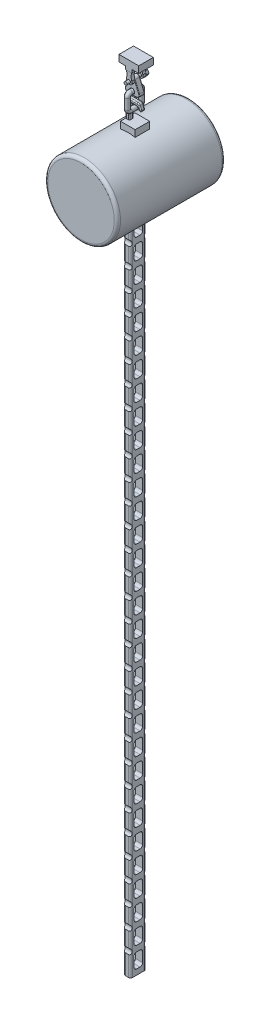
from build123d import *
from build123d.topology import SkipClean

# Parameters (mm, degrees)
SALIENTE_EXTRUIR1_DEPTH  = 28
CROQUIS2_W               = 10.7
CROQUIS2_H               = 6
SALIENTE_EXTRUIR2_DEPTH  = 21
REDONDEO1_R              = 1
CORTAR_EXTRUIR1_REACH    = 41.599
REDONDEO2_R              = 3
CORTAR_EXTRUIR2_REACH    = 41.599
CROQUIS5_R               = 2.815664582
SALIENTE_EXTRUIR3_DEPTH  = 5.5
SALIENTE_EXTRUIR4_START  = 34
CROQUIS7_R               = 2.815664582
SALIENTE_EXTRUIR4_DEPTH  = 34
CROQUIS8_R               = 2.815664582
SALIENTE_EXTRUIR5_DEPTH  = 10
CROQUIS9_R               = 4.7625
CORTAR_EXTRUIR3_DEPTH    = 10
REDONDEO3_R              = 1
CROQUIS10_R              = 4.35
SALIENTE_EXTRUIR6_DEPTH  = 11
CROQUIS11_R              = 4.35
SALIENTE_EXTRUIR7_DEPTH  = 8
CROQUIS13_W              = 28.274940987
CROQUIS13_H              = 11.511843281
SALIENTE_EXTRUIR8_DEPTH  = 10
CROQUIS14_W              = 28.274940987
CROQUIS14_H              = 11.511843281
SALIENTE_EXTRUIR9_DEPTH  = 10
REDONDEO4_R              = 2
SALIENTE_EXTRUIR10_DEPTH = 28
CROQUIS21_R              = 70
SALIENTE_EXTRUIR15_DEPTH = 90
CROQUIS22_R              = 70
SALIENTE_EXTRUIR16_DEPTH = 90
REDONDEO6_R              = 6
CROQUIS23_W              = 20
CROQUIS23_H              = 5.502758385
SALIENTE_EXTRUIR17_DEPTH = 30
CROQUIS24_W              = 13.86692414
CROQUIS24_H              = 30
SALIENTE_EXTRUIR18_DEPTH = 1265
CORTAR_EXTRUIR5_DEPTH    = 13.866924141
MATRIZL1_COUNT           = 32
MATRIZL1_PITCH           = 39.4
REDONDEO7_R              = 4
CORTAR_EXTRUIR6_DEPTH    = 20
MATRIZL2_COUNT           = 31
MATRIZL2_PITCH           = 39.4


# Some blends are built 0.0001 mm under size
with BuildPart() as part:
    # Croquis1 → Saliente-Extruir1 (new body)
    with BuildSketch(Plane.XY):
        Polygon((6.35, 0), (-6.35, 0), (-6.35, 6.35), (-19.05, 6.35), (-19.05, 19.05), (19.05, 19.05), (19.05, 6.35), (6.35, 6.35), align=None)
    extrude(amount=SALIENTE_EXTRUIR1_DEPTH)

    # Croquis2 → Saliente-Extruir2 (add)
    with BuildSketch(Plane.XZ):
        with Locations((0, 24.643277725)):
            Rectangle(CROQUIS2_W, CROQUIS2_H)
        with Locations((0, 3.356722275)):
            Rectangle(CROQUIS2_W, CROQUIS2_H)
    extrude(amount=SALIENTE_EXTRUIR2_DEPTH)

    # Redondeo1
    redondeo1_edges = [part.edges().sort_by_distance(p)[0] for p in [
        (6.35, 0, 14),
        (-6.35, 0, 14),
    ]]
    fillet(redondeo1_edges, radius=REDONDEO1_R - 0.0001)  # a hair under: the kernel refuses the full size

    # Cortar-Extruir1: up to this face of the body (flat: up to its plane)
    cortar_extruir1_end = Plane(part.part.faces().sort_by_distance((0, -10.5, 0.356722275))[0])
    # Croquis3 → Cortar-Extruir1 (cut, up to the picked face)
    with BuildSketch(Plane.XY.offset(27.643277725), mode=Mode.PRIVATE) as cortar_extruir1_sk1:
        with BuildLine():
            Line((5.35, 0), (6.520255164, -7.319974901))
            Line((6.520255164, -7.319974901), (5.35, -13.668985773))
            ThreePointArc((5.35, -13.668985773), (3.981826743, -6.834492886), (5.35, 0))
        make_face()
    cortar_extruir1_tool1 = split(extrude(cortar_extruir1_sk1.sketch, amount=-CORTAR_EXTRUIR1_REACH, mode=Mode.PRIVATE), bisect_by=cortar_extruir1_end, keep=Keep.BOTH, mode=Mode.PRIVATE)
    # Croquis3 → Cortar-Extruir1 (cut, up to the picked face)
    with BuildSketch(Plane.XY.offset(27.643277725), mode=Mode.PRIVATE) as cortar_extruir1_sk2:
        with BuildLine():
            Line((-5.35, 0), (-6.699224092, -7.319974901))
            Line((-6.699224092, -7.319974901), (-5.35, -13.668985773))
            ThreePointArc((-5.35, -13.668985773), (-3.981826743, -6.834492886), (-5.35, 0))
        make_face()
    cortar_extruir1_tool2 = split(extrude(cortar_extruir1_sk2.sketch, amount=-CORTAR_EXTRUIR1_REACH, mode=Mode.PRIVATE), bisect_by=cortar_extruir1_end, keep=Keep.BOTH, mode=Mode.PRIVATE)
    add(cortar_extruir1_tool1.solids().sort_by(Axis((5.166152, -6.89743, 27.643278), (0, 0, -1)))[0], mode=Mode.SUBTRACT)
    add(cortar_extruir1_tool2.solids().sort_by(Axis((-5.22362, -6.902982, 27.643278), (0, 0, -1)))[0], mode=Mode.SUBTRACT)

    # Redondeo2
    redondeo2_edges = [part.edges().sort_by_distance(p)[0] for p in [
        (5.35, -21, 24.643277725),
        (-5.35, -21, 24.643277725),
        (-5.35, -21, 3.356722275),
        (5.35, -21, 3.356722275),
    ]]
    fillet(redondeo2_edges, radius=REDONDEO2_R)

    # Cortar-Extruir2: up to this face of the body (flat: up to its plane)
    cortar_extruir2_end = Plane(part.part.faces().sort_by_distance((0, -10.77673572, 0.356722275))[0])
    # Croquis5 → Cortar-Extruir2 (cut, up to the picked face)
    with BuildSketch(Plane.XY.offset(27.643277725), mode=Mode.PRIVATE) as cortar_extruir2_sk1:
        with Locations((0, -16.615711475)):
            Circle(CROQUIS5_R)
    cortar_extruir2_tool1 = split(extrude(cortar_extruir2_sk1.sketch, amount=-CORTAR_EXTRUIR2_REACH, mode=Mode.PRIVATE), bisect_by=cortar_extruir2_end, keep=Keep.BOTH, mode=Mode.PRIVATE)
    add(cortar_extruir2_tool1.solids().sort_by(Axis((0, -16.615711, 27.643278), (0, 0, -1)))[0], mode=Mode.SUBTRACT)

    # Croquis6 → Saliente-Extruir3 (add)
    with BuildSketch(Plane(origin=(0, 0, 0.356722275), x_dir=(-1, 0, 0), z_dir=(0, 0, -1))):
        Polygon((5.773502692, -16.615711475), (2.886751346, -11.615711475), (-2.886751346, -11.615711475), (-5.773502692, -16.615711475), (-2.886751346, -21.615711475), (2.886751346, -21.615711475), align=None)
    extrude(amount=SALIENTE_EXTRUIR3_DEPTH)

    # Croquis7 → Saliente-Extruir4 (add)
    with BuildSketch(Plane.XY.offset(0.356722275).offset(SALIENTE_EXTRUIR4_START)):
        with Locations(Location((0, -16.615711475, 0), (0, 0, 180))):
            Circle(CROQUIS7_R)
    extrude(amount=-SALIENTE_EXTRUIR4_DEPTH)

    # Croquis8 → Saliente-Extruir5 (add)
    with BuildSketch(Plane(origin=(0, 0, 21.643277725), x_dir=(-1, 0, 0), z_dir=(0, 0, -1))):
        with BuildLine():
            Line((4.933623368, -14.546445792), (13.217945145, -34.298246566))
            ThreePointArc((13.217945145, -34.298246566), (12.681109686, -39.941264611), (7.684909592, -42.618918359))
            Line((7.684909592, -42.618918359), (-7.684909592, -42.618918359))
            ThreePointArc((-7.684909592, -42.618918359), (-12.681109686, -39.941264611), (-13.217945145, -34.298246566))
            Line((-13.217945145, -34.298246566), (-4.933623368, -14.546445792))
            ThreePointArc((-4.933623368, -14.546445792), (0, -11.265711475), (4.933623368, -14.546445792))
        make_face()
        with Locations((0, -16.615711475)):
            Circle(CROQUIS8_R, mode=Mode.SUBTRACT)
    extrude(amount=SALIENTE_EXTRUIR5_DEPTH)

    # Croquis9 → Cortar-Extruir3 (cut)
    with BuildSketch(Plane(origin=(0, 0, 11.643277725), x_dir=(-1, 0, 0), z_dir=(0, 0, -1))):
        with Locations((0, -35.818918359)):
            Circle(CROQUIS9_R)
    extrude(amount=-CORTAR_EXTRUIR3_DEPTH, mode=Mode.SUBTRACT)

    # Redondeo3
    # the kernel refuses this fillet: 1 mm, written as the material it takes off along each edge
    with BuildSketch(Plane(origin=(-4.383053419, -13.233755602, 21.643277725), x_dir=(0, 0, -1), z_dir=(-0.3867786322087512, -0.9221725921251008, 0))) as redondeo3_piece_1_section:
        with BuildLine():
            CenterArc((REDONDEO3_R, REDONDEO3_R), REDONDEO3_R, 180, 90)
            Line((0, REDONDEO3_R), (-REDONDEO3_R * 0.02, REDONDEO3_R))
            Line((-REDONDEO3_R * 0.02, REDONDEO3_R), (-REDONDEO3_R * 0.02, -REDONDEO3_R * 0.02))
            Line((-REDONDEO3_R * 0.02, -REDONDEO3_R * 0.02), (REDONDEO3_R, -REDONDEO3_R * 0.02))
            Line((REDONDEO3_R, -REDONDEO3_R * 0.02), (REDONDEO3_R, 0))
        make_face()
    redondeo3_piece_1 = extrude(amount=22.842243571, mode=Mode.PRIVATE)
    redondeo3_piece_1 = split(redondeo3_piece_1, bisect_by=Plane(origin=(-9.192169717, -25.214604853, 21.643277725), z_dir=(0, 0, -1)), keep=Keep.TOP, mode=Mode.PRIVATE)
    redondeo3_piece_1 = split(redondeo3_piece_1, bisect_by=Plane(origin=(-5.35, -25.214604853, 21.393450476), z_dir=(-1, 0, 0)), keep=Keep.TOP, mode=Mode.PRIVATE)
    add(redondeo3_piece_1, mode=Mode.SUBTRACT)
    with BuildSketch(Plane(origin=(-7.684909592, -36.618918359, 21.643277725), x_dir=(-0.922172592125097, 0.38677863220876035, 0), z_dir=(0.38677863220876035, 0.922172592125097, 0))) as redondeo3_piece_2:
        with BuildLine():
            CenterArc((6 - REDONDEO3_R, -REDONDEO3_R), REDONDEO3_R, 0, 90)
            Line((6, -REDONDEO3_R), (6 + REDONDEO3_R * 0.02, -REDONDEO3_R))
            Line((6 + REDONDEO3_R * 0.02, -REDONDEO3_R), (6 + REDONDEO3_R * 0.02, REDONDEO3_R * 0.02))
            Line((6 + REDONDEO3_R * 0.02, REDONDEO3_R * 0.02), (6 - REDONDEO3_R, REDONDEO3_R * 0.02))
            Line((6 - REDONDEO3_R, REDONDEO3_R * 0.02), (6 - REDONDEO3_R, 0))
        make_face()
    revolve(axis=Axis((-7.684909592, -36.618918359, 21.643277725), (0, 0, 1)), revolution_arc=112.754204396, mode=Mode.SUBTRACT)
    with BuildSketch(Plane(origin=(-7.684909592, -42.618918359, 21.643277725), x_dir=(0, 1, 0), z_dir=(1, 0, 0))) as redondeo3_piece_3:
        with BuildLine():
            CenterArc((REDONDEO3_R, -REDONDEO3_R), REDONDEO3_R, 90, 90)
            Line((0, -REDONDEO3_R), (-REDONDEO3_R * 0.02, -REDONDEO3_R))
            Line((-REDONDEO3_R * 0.02, -REDONDEO3_R), (-REDONDEO3_R * 0.02, REDONDEO3_R * 0.02))
            Line((-REDONDEO3_R * 0.02, REDONDEO3_R * 0.02), (REDONDEO3_R, REDONDEO3_R * 0.02))
            Line((REDONDEO3_R, REDONDEO3_R * 0.02), (REDONDEO3_R, 0))
        make_face()
    extrude(amount=15.369819184, mode=Mode.SUBTRACT)
    with BuildSketch(Plane(origin=(7.684909592, -36.618918359, 21.643277725), x_dir=(0, -1, 0), z_dir=(-1, 0, 0))) as redondeo3_piece_4:
        with BuildLine():
            CenterArc((6 - REDONDEO3_R, -REDONDEO3_R), REDONDEO3_R, 0, 90)
            Line((6, -REDONDEO3_R), (6 + REDONDEO3_R * 0.02, -REDONDEO3_R))
            Line((6 + REDONDEO3_R * 0.02, -REDONDEO3_R), (6 + REDONDEO3_R * 0.02, REDONDEO3_R * 0.02))
            Line((6 + REDONDEO3_R * 0.02, REDONDEO3_R * 0.02), (6 - REDONDEO3_R, REDONDEO3_R * 0.02))
            Line((6 - REDONDEO3_R, REDONDEO3_R * 0.02), (6 - REDONDEO3_R, 0))
        make_face()
    revolve(axis=Axis((7.684909592, -36.618918359, 21.643277725), (0, 0, 1)), revolution_arc=112.754204396, mode=Mode.SUBTRACT)
    with BuildSketch(Plane(origin=(0, -16.615711475, 11.643277725), x_dir=(0.9221725921251007, 0.3867786322087513, 0), z_dir=(0.3867786322087513, -0.9221725921251007, 0))) as redondeo3_piece_5:
        with BuildLine():
            CenterArc((5.35 - REDONDEO3_R, REDONDEO3_R), REDONDEO3_R, 270, 90)
            Line((5.35 - REDONDEO3_R, 0), (5.35 - REDONDEO3_R, -REDONDEO3_R * 0.02))
            Line((5.35 - REDONDEO3_R, -REDONDEO3_R * 0.02), (5.35 + REDONDEO3_R * 0.02, -REDONDEO3_R * 0.02))
            Line((5.35 + REDONDEO3_R * 0.02, -REDONDEO3_R * 0.02), (5.35 + REDONDEO3_R * 0.02, REDONDEO3_R))
            Line((5.35 + REDONDEO3_R * 0.02, REDONDEO3_R), (5.35, REDONDEO3_R))
        make_face()
    revolve(axis=Axis((0, -16.615711475, 11.643277725), (0, 0, 1)), revolution_arc=134.491591209, mode=Mode.SUBTRACT)
    with BuildSketch(Plane(origin=(-4.933623368, -14.546445792, 11.643277725), x_dir=(0, 0, 1), z_dir=(-0.3867786322087512, -0.9221725921251008, 0)), Plane(origin=(13.217945145, -34.298246566, 11.643277725), x_dir=(0, 0, 1), z_dir=(-0.3867786322087514, 0.9221725921251008, 0))) as redondeo3_piece_6:
        with BuildLine():
            CenterArc((REDONDEO3_R, -REDONDEO3_R), REDONDEO3_R, 90, 90)
            Line((0, -REDONDEO3_R), (-REDONDEO3_R * 0.02, -REDONDEO3_R))
            Line((-REDONDEO3_R * 0.02, -REDONDEO3_R), (-REDONDEO3_R * 0.02, REDONDEO3_R * 0.02))
            Line((-REDONDEO3_R * 0.02, REDONDEO3_R * 0.02), (REDONDEO3_R, REDONDEO3_R * 0.02))
            Line((REDONDEO3_R, REDONDEO3_R * 0.02), (REDONDEO3_R, 0))
        make_face()
    extrude(amount=21.418767964, mode=Mode.SUBTRACT)
    with BuildSketch(Plane(origin=(-7.684909592, -36.618918359, 11.643277725), x_dir=(-0.922172592125097, 0.38677863220876035, 0), z_dir=(0.38677863220876035, 0.922172592125097, 0))) as redondeo3_piece_7:
        with BuildLine():
            CenterArc((6 - REDONDEO3_R, REDONDEO3_R), REDONDEO3_R, 270, 90)
            Line((6, REDONDEO3_R), (6 + REDONDEO3_R * 0.02, REDONDEO3_R))
            Line((6 + REDONDEO3_R * 0.02, REDONDEO3_R), (6 + REDONDEO3_R * 0.02, -REDONDEO3_R * 0.02))
            Line((6 + REDONDEO3_R * 0.02, -REDONDEO3_R * 0.02), (6 - REDONDEO3_R, -REDONDEO3_R * 0.02))
            Line((6 - REDONDEO3_R, -REDONDEO3_R * 0.02), (6 - REDONDEO3_R, 0))
        make_face()
    revolve(axis=Axis((-7.684909592, -36.618918359, 11.643277725), (0, 0, 1)), revolution_arc=112.754204396, mode=Mode.SUBTRACT)
    with BuildSketch(Plane(origin=(-7.684909592, -42.618918359, 11.643277725), x_dir=(0, 1, 0), z_dir=(1, 0, 0))) as redondeo3_piece_8:
        with BuildLine():
            CenterArc((REDONDEO3_R, REDONDEO3_R), REDONDEO3_R, 180, 90)
            Line((0, REDONDEO3_R), (-REDONDEO3_R * 0.02, REDONDEO3_R))
            Line((-REDONDEO3_R * 0.02, REDONDEO3_R), (-REDONDEO3_R * 0.02, -REDONDEO3_R * 0.02))
            Line((-REDONDEO3_R * 0.02, -REDONDEO3_R * 0.02), (REDONDEO3_R, -REDONDEO3_R * 0.02))
            Line((REDONDEO3_R, -REDONDEO3_R * 0.02), (REDONDEO3_R, 0))
        make_face()
    extrude(amount=15.369819184, mode=Mode.SUBTRACT)
    with BuildSketch(Plane(origin=(7.684909592, -36.618918359, 11.643277725), x_dir=(0, -1, 0), z_dir=(-1, 0, 0))) as redondeo3_piece_9:
        with BuildLine():
            CenterArc((6 - REDONDEO3_R, REDONDEO3_R), REDONDEO3_R, 270, 90)
            Line((6, REDONDEO3_R), (6 + REDONDEO3_R * 0.02, REDONDEO3_R))
            Line((6 + REDONDEO3_R * 0.02, REDONDEO3_R), (6 + REDONDEO3_R * 0.02, -REDONDEO3_R * 0.02))
            Line((6 + REDONDEO3_R * 0.02, -REDONDEO3_R * 0.02), (6 - REDONDEO3_R, -REDONDEO3_R * 0.02))
            Line((6 - REDONDEO3_R, -REDONDEO3_R * 0.02), (6 - REDONDEO3_R, 0))
        make_face()
    revolve(axis=Axis((7.684909592, -36.618918359, 11.643277725), (0, 0, 1)), revolution_arc=112.754204396, mode=Mode.SUBTRACT)
    with BuildSketch(Plane(origin=(13.217945145, -34.298246566, 21.643277725), x_dir=(0, 0, -1), z_dir=(-0.3867786322087514, 0.9221725921251008, 0))) as redondeo3_piece_10_section:
        with BuildLine():
            CenterArc((REDONDEO3_R, REDONDEO3_R), REDONDEO3_R, 180, 90)
            Line((0, REDONDEO3_R), (-REDONDEO3_R * 0.02, REDONDEO3_R))
            Line((-REDONDEO3_R * 0.02, REDONDEO3_R), (-REDONDEO3_R * 0.02, -REDONDEO3_R * 0.02))
            Line((-REDONDEO3_R * 0.02, -REDONDEO3_R * 0.02), (REDONDEO3_R, -REDONDEO3_R * 0.02))
            Line((REDONDEO3_R, -REDONDEO3_R * 0.02), (REDONDEO3_R, 0))
        make_face()
    redondeo3_piece_10 = extrude(amount=22.842243571, mode=Mode.PRIVATE)
    redondeo3_piece_10 = split(redondeo3_piece_10, bisect_by=Plane(origin=(9.192169717, -25.214604853, 21.643277725), z_dir=(0, 0, -1)), keep=Keep.TOP, mode=Mode.PRIVATE)
    redondeo3_piece_10 = split(redondeo3_piece_10, bisect_by=Plane(origin=(5.35, -25.214604853, 21.393450476), z_dir=(1, 0, 0)), keep=Keep.TOP, mode=Mode.PRIVATE)
    add(redondeo3_piece_10, mode=Mode.SUBTRACT)


with BuildPart() as body_2:
    # Croquis10 → Saliente-Extruir6 (new body)
    with BuildSketch(Plane(origin=(0, 0, 11.643277725), x_dir=(-1, 0, 0), z_dir=(0, 0, -1))):
        with Locations((0, -35.818918359)):
            Circle(CROQUIS10_R)
    extrude(amount=-SALIENTE_EXTRUIR6_DEPTH)

    # Barrer1: sweep along a curve in space
    with BuildLine() as barrer1_path:
        Line((0, -35.818918359, 22.643277725), (0, -35.818918359, 25.643277725))
        ThreePointArc((0, -35.818918359, 25.643277725), (0, -37.283384453, 29.178811631), (0, -40.818918359, 30.643277725))
        Line((0, -40.818918359, 30.643277725), (0, -60.818918359, 30.643277725))
        ThreePointArc((0, -60.818918359, 30.643277725), (0, -64.354452265, 29.178811631), (0, -65.818918359, 25.643277725))
        Line((0, -65.818918359, 25.643277725), (0, -65.818918359, 8.643277725))
        ThreePointArc((0, -65.818918359, 8.643277725), (0, -64.354452265, 5.107743819), (0, -60.818918359, 3.643277725))
        Line((0, -60.818918359, 3.643277725), (0, -40.818918359, 3.643277725))
        ThreePointArc((0, -35.818918359, 8.643277725), (0, -37.283384453, 5.107743819), (0, -40.818918359, 3.643277725))
        Line((0, -35.818918359, 8.643277725), (0, -35.818918359, 11.643277725))
    # Croquis11 → Barrer1 (sweep)
    with BuildSketch(Plane.XY.offset(22.643277725)):
        with Locations((0, -35.818918359)):
            Circle(CROQUIS11_R)
    sweep(path=barrer1_path.line)


with BuildPart() as body_3:
    # Croquis12 → Saliente-Extruir7 (new body)
    with BuildSketch(Plane(origin=(0, 0, 11.643277725), x_dir=(-1, 0, 0), z_dir=(0, 0, -1))):
        with BuildLine():
            Line((-5.818655397, -59.40281157), (5.381115139, -59.40281157))
            ThreePointArc((5.381115139, -59.40281157), (6.795328702, -59.988598008), (7.381115139, -61.40281157))
            Line((7.381115139, -61.40281157), (7.381115139, -89.417879828))
            Line((7.381115139, -89.417879828), (-13.686610906, -89.417879828))
            Line((-13.686610906, -89.417879828), (-13.686610906, -100.929723109))
            Line((-13.686610906, -100.929723109), (14.588330081, -100.929723109))
            Line((14.588330081, -100.929723109), (14.588330081, -57.596469218))
            ThreePointArc((14.588330081, -57.596469218), (13.123863987, -54.060935312), (9.588330081, -52.596469218))
            Line((9.588330081, -52.596469218), (-7.405387753, -52.596469218))
            ThreePointArc((-7.405387753, -52.596469218), (-10.218597223, -53.462965562), (-12.056752406, -55.762128228))
            Line((-12.056752406, -55.762128228), (-14.815295773, -62.757006052))
            ThreePointArc((-14.815295773, -62.757006052), (-14.789184488, -64.287517062), (-13.688486308, -65.351288309))
            Line((-13.688486308, -65.351288309), (-13.600253639, -65.386084291))
            ThreePointArc((-13.600253639, -65.386084291), (-12.38001879, -65.465466072), (-11.341646131, -64.819666744))
            Line((-11.341646131, -64.819666744), (-7.343526509, -60.108683257))
            ThreePointArc((-7.343526509, -60.108683257), (-6.6588171, -59.587838206), (-5.818655397, -59.40281157))
        make_face()
    extrude(amount=-SALIENTE_EXTRUIR7_DEPTH)

    # Croquis13 → Saliente-Extruir8 (add)
    with BuildSketch(Plane(origin=(0, 0, 11.643277725), x_dir=(-1, 0, 0), z_dir=(0, 0, -1))):
        with Locations((0.450859588, -95.173801469)):
            Rectangle(CROQUIS13_W, CROQUIS13_H)
    extrude(amount=SALIENTE_EXTRUIR8_DEPTH)

    # Croquis14 → Saliente-Extruir9 (add)
    with BuildSketch(Plane.XY.offset(19.643277725)):
        with Locations((-0.450859588, -95.173801469)):
            Rectangle(CROQUIS14_W, CROQUIS14_H)
    extrude(amount=SALIENTE_EXTRUIR9_DEPTH)

    # Redondeo4
    redondeo4_edges = [body_3.edges().sort_by_distance(p)[0] for p in [
        (10.218597223, -53.462965562, 19.643277725),
        (13.436024089, -59.25956714, 19.643277725),
        (-7.381115139, -75.410345699, 11.643277725),
        (14.789184488, -64.287517062, 19.643277725),
        (-6.795328702, -59.988598008, 11.643277725),
        (0.218770129, -59.40281157, 11.643277725),
        (6.6588171, -59.587838206, 11.643277725),
        (9.34258632, -62.464175, 11.643277725),
        (12.38001879, -65.465466072, 11.643277725),
        (13.644369973, -65.3686863, 11.643277725),
        (14.789184488, -64.287517062, 11.643277725),
        (13.436024089, -59.25956714, 11.643277725),
        (13.644369973, -65.3686863, 19.643277725),
        (10.218597223, -53.462965562, 11.643277725),
        (-1.091471164, -52.596469218, 11.643277725),
        (-13.123863987, -54.060935312, 11.643277725),
        (12.38001879, -65.465466072, 19.643277725),
        (9.34258632, -62.464175, 19.643277725),
        (6.6588171, -59.587838206, 19.643277725),
        (0.218770129, -59.40281157, 19.643277725),
        (-6.795328702, -59.988598008, 19.643277725),
        (-7.381115139, -75.410345699, 19.643277725),
        (-13.123863987, -54.060935312, 19.643277725),
        (-14.588330081, -73.507174523, 11.643277725),
        (-14.588330081, -73.507174523, 19.643277725),
        (-1.091471164, -52.596469218, 19.643277725),
    ]]
    fillet(redondeo4_edges, radius=REDONDEO4_R)

    # Croquis15 → Saliente-Extruir10 (add)
    with BuildSketch(Plane(origin=(0, 0, 1.643277725), x_dir=(-1, 0, 0), z_dir=(0, 0, -1))):
        with BuildLine():
            Line((-13.686610906, -100.929723109), (-13.686610906, -102.372214928))
            ThreePointArc((-13.686610906, -102.372214928), (0.450859588, -240.929723109), (14.588330081, -102.372214928))
            Line((14.588330081, -102.372214928), (14.588330081, -100.929723109))
            Line((14.588330081, -100.929723109), (-13.686610906, -100.929723109))
        make_face()
    extrude(amount=-SALIENTE_EXTRUIR10_DEPTH)

    # Croquis21 → Saliente-Extruir15 (add)
    with SkipClean():  # the faces are left unmerged after this step: merging them gives an invalid solid
        with BuildSketch(Plane(origin=(0, 0, 1.643277725), x_dir=(-1, 0, 0), z_dir=(0, 0, -1))):
            with Locations((0.450859588, -170.929723109)):
                Circle(CROQUIS21_R)
        extrude(amount=SALIENTE_EXTRUIR15_DEPTH)

    # Croquis22 → Saliente-Extruir16 (add)
    with SkipClean():  # the faces are left unmerged after this step: merging them gives an invalid solid
        with BuildSketch(Plane.XY.offset(29.643277725)):
            with Locations(Location((-0.450859588, -170.929723109, 0), (0, 0, 180))):
                Circle(CROQUIS22_R)
        extrude(amount=SALIENTE_EXTRUIR16_DEPTH)

    # Redondeo6
    redondeo6_edges = [body_3.edges().sort_by_distance(p)[0] for p in [
        (69.549140412, -170.929723109, -88.356722275),
        (69.549140412, -170.929723109, 119.643277725),
    ]]
    fillet(redondeo6_edges, radius=REDONDEO6_R)

    # Croquis23 → Saliente-Extruir17 (add)
    with SkipClean():  # the faces are left unmerged after this step: merging them gives an invalid solid
        with BuildSketch(Plane(origin=(0, 0, 1.643277725), x_dir=(-1, 0, 0), z_dir=(0, 0, -1))):
            with Locations((0.450859588, -240.929723109)):
                Rectangle(CROQUIS23_W, CROQUIS23_H)
        extrude(amount=-SALIENTE_EXTRUIR17_DEPTH)

    # Croquis24 → Saliente-Extruir18 (add)
    with SkipClean():  # the faces are left unmerged after this step: merging them gives an invalid solid
        with BuildSketch(Plane.XZ.offset(243.681102301)):
            with Locations((0, 16.643277725)):
                Rectangle(CROQUIS24_W, CROQUIS24_H)
        extrude(amount=SALIENTE_EXTRUIR18_DEPTH)

    # Croquis25 → Cortar-Extruir5 (cut)
    with SkipClean():  # the faces are left unmerged after this step: merging them gives an invalid solid
        with BuildSketch(Plane(origin=(6.93346207, 0, 0), x_dir=(0, 0, -1), z_dir=(1, 0, 0))):
            with BuildLine():
                ThreePointArc((-24.880566509, -253.495308929), (-23.416100415, -249.959775023), (-19.880566509, -248.495308929))
                Line((-19.880566509, -248.495308929), (-13.405988942, -248.495308929))
                ThreePointArc((-13.405988942, -248.495308929), (-9.870455036, -249.959775023), (-8.405988942, -253.495308929))
                Line((-8.405988942, -253.495308929), (-8.405988942, -271.866895674))
                ThreePointArc((-8.405988942, -271.866895674), (-9.870455036, -275.40242958), (-13.405988942, -276.866895674))
                Line((-13.405988942, -276.866895674), (-19.880566509, -276.866895674))
                ThreePointArc((-19.880566509, -276.866895674), (-23.416100415, -275.40242958), (-24.880566509, -271.866895674))
                Line((-24.880566509, -271.866895674), (-24.880566509, -253.495308929))
            make_face()
        cortar_extruir5 = extrude(amount=-CORTAR_EXTRUIR5_DEPTH, mode=Mode.SUBTRACT)

    # MatrizL1: Cortar-Extruir5 ×32
    with SkipClean():  # the faces are left unmerged after this step: merging them gives an invalid solid
        with Locations(*[(0, -i * MATRIZL1_PITCH, 0) for i in range(1, MATRIZL1_COUNT)]):
            add(cortar_extruir5, mode=Mode.SUBTRACT)

    # Redondeo7
    # the kernel refuses this fillet: 4 mm, written as the material it takes off along each edge
    with BuildSketch(Plane(origin=(6.93346207, -243.681102301, 1.643277725), x_dir=(-1, 0, 0), z_dir=(0, -1, 0)), Plane(origin=(-6.93346207, -243.681102301, 31.643277725), x_dir=(1, 0, 0), z_dir=(0, -1, 0))) as redondeo7_piece_1:
        with BuildLine():
            CenterArc((REDONDEO7_R, -REDONDEO7_R), REDONDEO7_R, 90, 90)
            Line((0, -REDONDEO7_R), (0, 0))
            Line((0, 0), (REDONDEO7_R, 0))
        make_face()
    extrude(amount=1275, mode=Mode.SUBTRACT)
    with BuildSketch(Plane(origin=(6.93346207, -243.681102301, 31.643277725), x_dir=(-1, 0, 0), z_dir=(0, -1, 0)), Plane(origin=(-6.93346207, -243.681102301, 1.643277725), x_dir=(1, 0, 0), z_dir=(0, -1, 0))) as redondeo7_piece_2:
        with BuildLine():
            CenterArc((REDONDEO7_R, REDONDEO7_R), REDONDEO7_R, 180, 90)
            Line((0, REDONDEO7_R), (0, 0))
            Line((0, 0), (REDONDEO7_R, 0))
        make_face()
    extrude(amount=1275, mode=Mode.SUBTRACT)

    # Croquis26 → Cortar-Extruir6 (cut)
    with BuildSketch(Plane(origin=(6.93346207, 0, 0), x_dir=(0, 0, -1), z_dir=(1, 0, 0))):
        with BuildLine():
            Line((-31.643277725, -277.442524394), (-35.142969647, -281.643639967))
            Line((-35.142969647, -281.643639967), (-31.643277725, -288.31855357))
            ThreePointArc((-31.643277725, -288.31855357), (-28.535046247, -282.880538982), (-31.643277725, -277.442524394))
        make_face()
        with BuildLine():
            Line((-1.643277725, -277.442524394), (1.559652925, -282.880538982))
            Line((1.559652925, -282.880538982), (-1.643277725, -288.31855357))
            ThreePointArc((-1.643277725, -288.31855357), (-4.751509204, -282.880538982), (-1.643277725, -277.442524394))
        make_face()
    cortar_extruir6 = extrude(amount=-CORTAR_EXTRUIR6_DEPTH, mode=Mode.SUBTRACT)

    # MatrizL2: Cortar-Extruir6 ×31
    with Locations(*[(0, -i * MATRIZL2_PITCH, 0) for i in range(1, MATRIZL2_COUNT)]):
        add(cortar_extruir6, mode=Mode.SUBTRACT)


solid = Compound([part.part, body_2.part, body_3.part])
